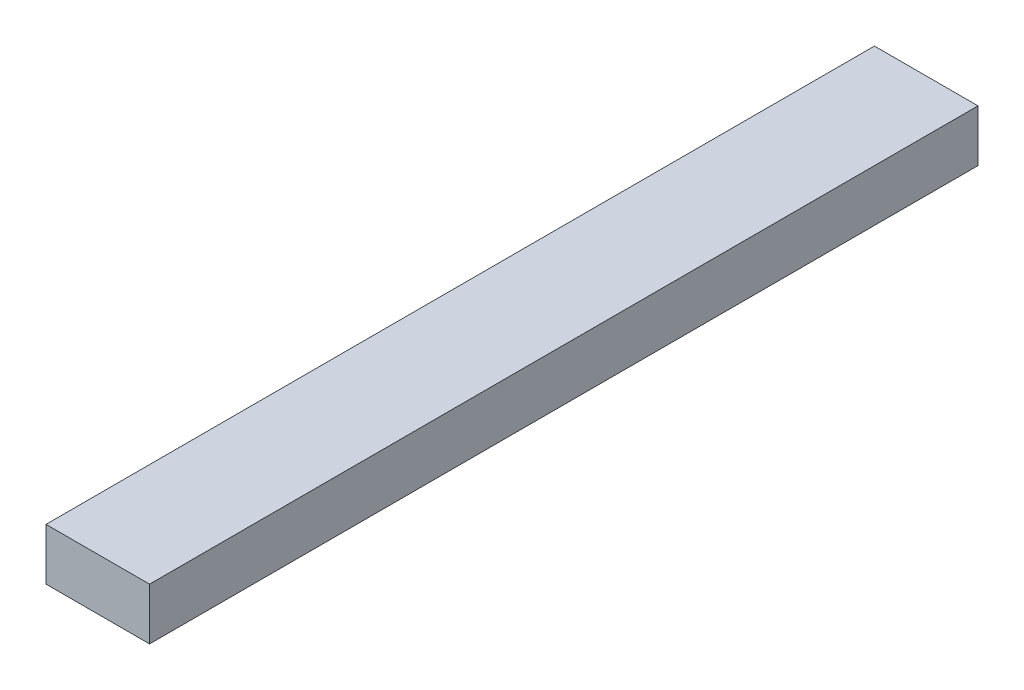
from build123d import *

# Parameters (mm, degrees)
SKETCH1_W           = 25.4
SKETCH1_H           = 12.7
BOSS_EXTRUDE1_DEPTH = 203.2
SKETCH4_W           = 22.86
SKETCH4_H           = 10.16
CUT_EXTRUDE1_DEPTH  = 107.95


with BuildPart() as part:
    # Sketch1 → Boss-Extrude1 (new body)
    with BuildSketch(Plane.XY):
        Rectangle(SKETCH1_W, SKETCH1_H)
    extrude(amount=BOSS_EXTRUDE1_DEPTH)

    # Sketch4 → Cut-Extrude1 (cut)
    with BuildSketch(Plane(origin=(0, 0, 0), x_dir=(-1, 0, 0), z_dir=(0, 0, -1))):
        Rectangle(SKETCH4_W, SKETCH4_H)
    extrude(amount=-CUT_EXTRUDE1_DEPTH, mode=Mode.SUBTRACT)


solid = part.part
